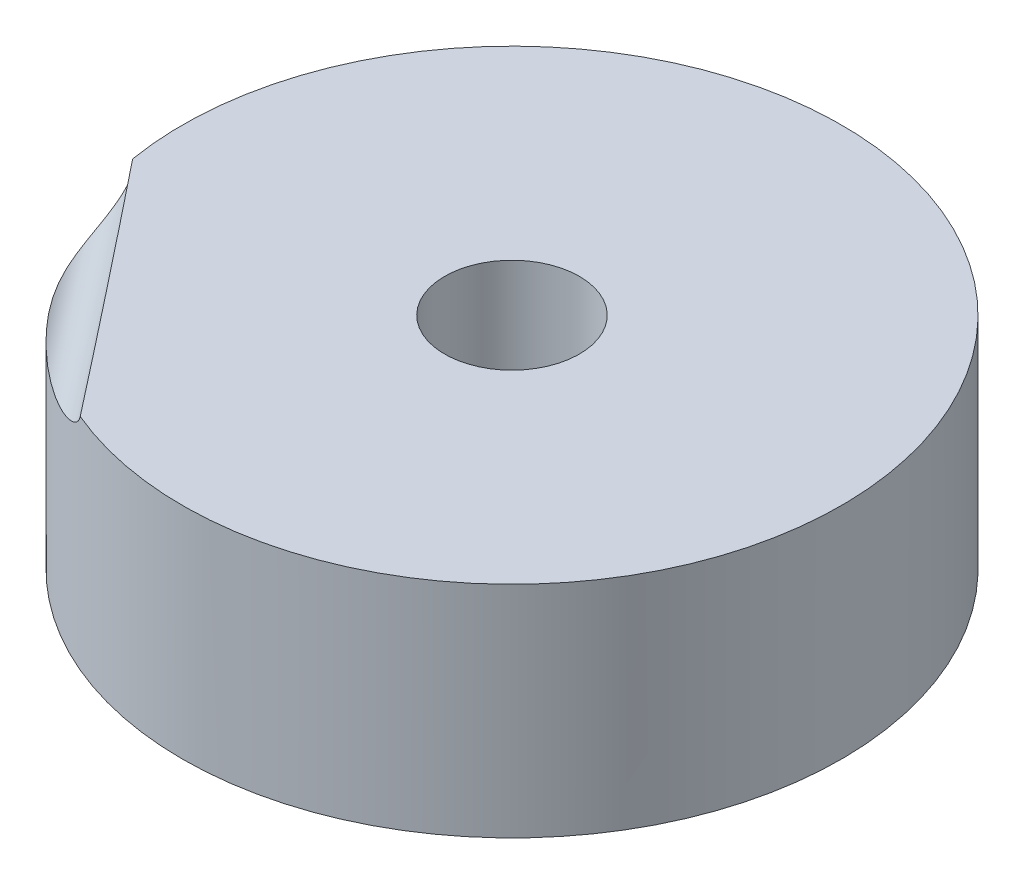
from build123d import *

# Parameters (mm, degrees)
SKETCH2_R           = 28.575
SKETCH2_R_2         = 5.842
BOSS_EXTRUDE1_DEPTH = 19.05
SKETCH3_R           = 2.3495
CUT_EXTRUDE1_DEPTH  = 204.685150759


with BuildPart() as part:
    # Sketch2 → Boss-Extrude1 (new body)
    with BuildSketch(Plane(origin=(0, 0, 0), x_dir=(1, 0, 0), z_dir=(0, 1, 0))):
        Circle(SKETCH2_R)
        Circle(SKETCH2_R_2, mode=Mode.SUBTRACT)
    extrude(amount=BOSS_EXTRUDE1_DEPTH)

    # Sketch3 → Cut-Extrude1 (cut, through all)
    with BuildSketch(Plane(origin=(-16.545636827, 184.752127538, -44.352499219), x_dir=(-0.7851291614483606, 0.0006136742891857283, 0.6193317554003355), z_dir=(-0.6190324269520984, -0.03188005298701784, -0.784718112829913))):
        with Locations((41.721218349, -167.120322092)):
            Circle(SKETCH3_R)
        with Locations((44.049502294, 14.21950649)):
            Circle(SKETCH3_R)
    extrude(amount=-CUT_EXTRUDE1_DEPTH, mode=Mode.SUBTRACT)


solid = part.part
